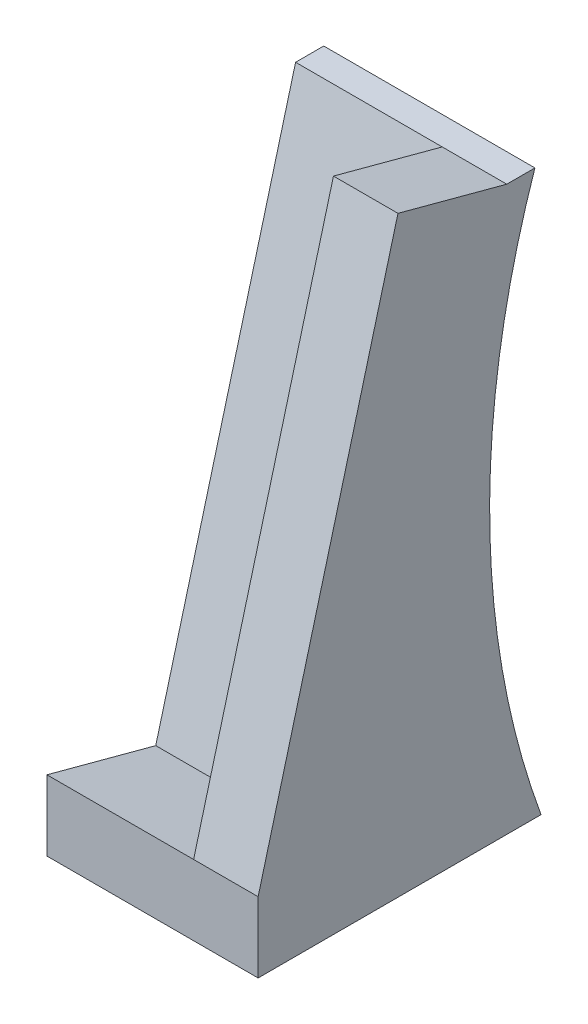
from build123d import *

# Parameters (mm, degrees)
BOSS_EXTRUDE1_DEPTH = 38.1
SKETCH2_W           = 11.640498825
SKETCH2_H           = 97.480780029
BOSS_EXTRUDE2_DEPTH = 20.32


with BuildPart() as part:
    # Sketch1 → Boss-Extrude1 (new body)
    with BuildSketch(Plane(origin=(0, 0, 0), x_dir=(0, 0, -1), z_dir=(1, 0, 0))):
        with BuildLine():
            Line((0, 0), (51.044233981, 0))
            ThreePointArc((51.044233981, 0), (41.774414057, 50.705050847), (49.937495193, 101.6))
            Line((49.937495193, 101.6), (44.857495193, 101.6))
            Line((44.857495193, 101.6), (19.62761279, 7.440797004))
            Line((19.62761279, 7.440797004), (0, 12.7))
            Line((0, 12.7), (0, 0))
        make_face()
    extrude(amount=BOSS_EXTRUDE1_DEPTH)

    # Sketch2 → Boss-Extrude2 (add)
    with BuildSketch(Plane(origin=(0, -4.408464311, -16.45261279), x_dir=(1, 0, 0), z_dir=(0, 0.258819045102514, 0.9659258262890702))):
        with Locations((32.279750588, 61.007648009)):
            Rectangle(SKETCH2_W, SKETCH2_H)
    extrude(amount=BOSS_EXTRUDE2_DEPTH)


solid = part.part
